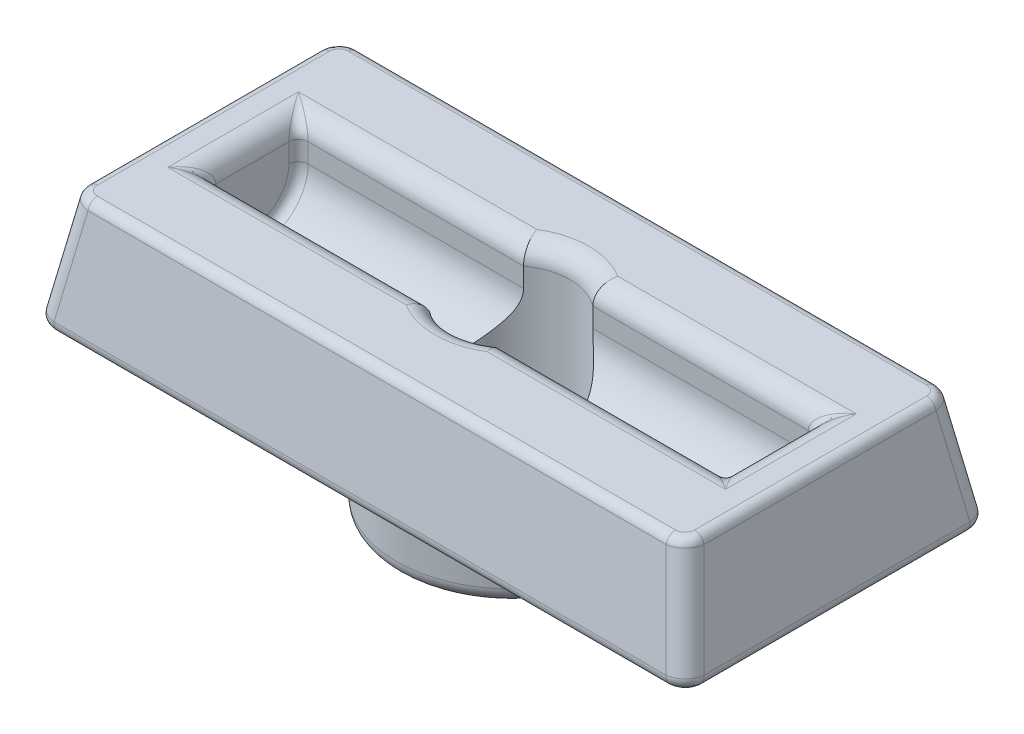
from build123d import *

# Parameters (mm, degrees)
SKETCH1_W           = 17
SKETCH1_H           = 8
EXTRUDE1_DEPTH      = 3
EXTRUDE1_TAPER      = 10
EXTRUDE2_DEPTH      = 6.75
EXTRUDE2_DEPTH_BACK = 6.75
SKETCH4_R           = 3
EXTRUDE4_DEPTH      = 2
SKETCH3_R           = 1.5
EXTRUDE3_DEPTH      = 11.641898444
FILLET1_R           = 0.5
FILLET3_R           = 0.25
FILLET4_R           = 0.4


with BuildPart() as part:
    # Sketch1 → Extrude1 (new body)
    with BuildSketch(Plane(origin=(0, 0, 0), x_dir=(1, 0, 0), z_dir=(0, 1, 0))):
        Rectangle(SKETCH1_W, SKETCH1_H)
    extrude(amount=EXTRUDE1_DEPTH, taper=EXTRUDE1_TAPER)

    # Sketch2 → Extrude2 (cut, two sides: drawn at the far end of the back side and taken through both)
    with BuildSketch(Plane(origin=(0, 0, 0), x_dir=(0, 0, -1), z_dir=(1, 0, 0)).offset(-EXTRUDE2_DEPTH_BACK)):
        with BuildLine():
            Line((-1.2, 2), (-1.2, 3))
            Line((-1.2, 3), (1.2, 3))
            Line((1.2, 3), (1.2, 2))
            ThreePointArc((1.2, 2), (0, 0.8), (-1.2, 2))
        make_face()
    extrude(amount=EXTRUDE2_DEPTH + EXTRUDE2_DEPTH_BACK, mode=Mode.SUBTRACT)

    # Sketch4 → Extrude4 (add)
    with BuildSketch(Plane.XZ):
        Circle(SKETCH4_R)
    extrude(amount=EXTRUDE4_DEPTH)

    # Sketch3 → Extrude3 (cut, through all)
    with BuildSketch(Plane(origin=(0, 3, 0), x_dir=(1, 0, 0), z_dir=(0, 1, 0))):
        Circle(SKETCH3_R)
    extrude(amount=-EXTRUDE3_DEPTH, mode=Mode.SUBTRACT)

    # Fillet1
    fillet1_edges = [part.edges().sort_by_distance(p)[0] for p in [
        (-3.825, 3, -1.2),
        (-6.75, 3, 0),
        (-3.825, 3, 1.2),
        (0, 3, 1.5),
        (3.825, 3, 1.2),
        (6.75, 3, 0),
        (3.825, 3, -1.2),
        (0, 3, -1.5),
        (-8.235509529, 1.5, -3.735509529),
        (-8.235509529, 1.5, 3.735509529),
        (8.235509529, 1.5, 3.735509529),
        (8.235509529, 1.5, -3.735509529),
    ]]
    fillet(fillet1_edges, radius=FILLET1_R)

    # Fillet3
    fillet3_edges = [part.edges().sort_by_distance(p)[0] for p in [
        (-7.827685775, 3, -3.327685775),
        (0, 3, -3.471019058),
        (7.827685775, 3, -3.327685775),
        (7.971019058, 3, 0),
        (7.827685775, 3, 3.327685775),
        (0, 3, 3.471019058),
        (-7.827685775, 3, 3.327685775),
        (6.926975546, 2.881648008, 1.376975546),
        (6.75, 2.25, 1.2),
        (6.926975546, 2.881648008, -1.376975546),
        (6.75, 2.25, -1.2),
        (-6.926975546, 2.881648008, 1.376975546),
        (-6.75, 2.25, 1.2),
        (-6.926975546, 2.881648008, -1.376975546),
        (-6.75, 2.25, -1.2),
        (-7.971019058, 3, 0),
        (6.75, 0.8, 0),
        (-6.75, 0.8, 0),
        (0, 0, 4),
        (8.356666717, 0, 3.856666717),
        (8.5, 0, 0),
        (8.356666717, 0, -3.856666717),
        (-8.356666717, 0, 3.856666717),
        (-8.5, 0, 0),
        (-8.356666717, 0, -3.856666717),
        (0, 0, -4),
    ]]
    fillet(fillet3_edges, radius=FILLET3_R)

    # Fillet4
    fillet4_edges = [part.edges().sort_by_distance(p)[0] for p in [
        (-3, -2, 0),
    ]]
    fillet(fillet4_edges, radius=FILLET4_R)


solid = part.part
